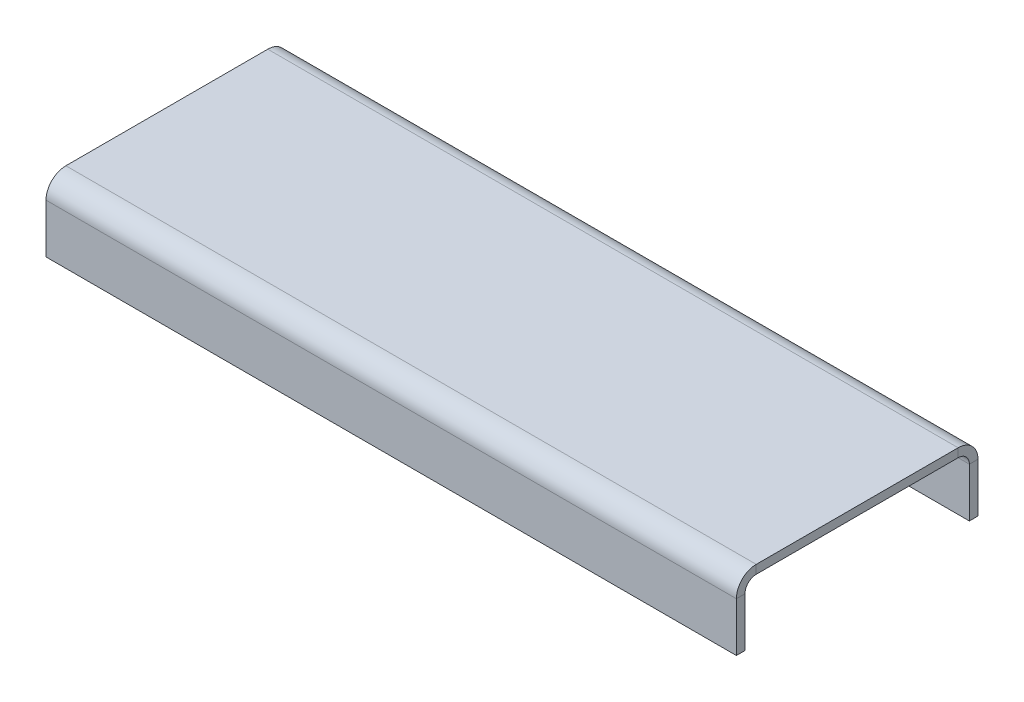
from build123d import *

# Parameters (mm, degrees)
SKETCH1_W                      = 800
SKETCH1_H                      = 280
BASE_FLANGE1_DEPTH             = 10
EDGE_FLANGE1_STRIP_W           = 66
EDGE_FLANGE1_STRIP_H           = 10
EDGE_FLANGE1_STRIP_CUT_DEPTH   = 800
EDGE_FLANGE1_STRIP_2_W         = 66
EDGE_FLANGE1_STRIP_2_H         = 10
EDGE_FLANGE1_STRIP_CUT_2_DEPTH = 800
EDGE_FLANGE1_DEPTH             = 800
EDGE_FLANGE1_BEND_DEPTH        = 800


# Sheet-metal steps are written as plain solids
with BuildPart() as part:
    # Sketch1 → Base-Flange1 (new body)
    with BuildSketch(Plane(origin=(0, 0, 0), x_dir=(1, 0, 0), z_dir=(0, 1, 0))):
        Rectangle(SKETCH1_W, SKETCH1_H)
    extrude(amount=-BASE_FLANGE1_DEPTH)

    # Edge-Flange1 strip (across the edge) → Edge-Flange1 strip cut (cut)
    with BuildSketch(Plane(origin=(400, -10, 140), x_dir=(0, 0, -1), z_dir=(-1, 0, 0))):
        with Locations((-10, -5)):
            Rectangle(EDGE_FLANGE1_STRIP_W, EDGE_FLANGE1_STRIP_H)
    extrude(amount=EDGE_FLANGE1_STRIP_CUT_DEPTH, mode=Mode.SUBTRACT)

    # Edge-Flange1 strip 2 (across the edge) → Edge-Flange1 strip cut 2 (cut)
    with BuildSketch(Plane(origin=(-400, -10, -140), x_dir=(0, 0, 1), z_dir=(1, 0, 0))):
        with Locations((-10, -5)):
            Rectangle(EDGE_FLANGE1_STRIP_2_W, EDGE_FLANGE1_STRIP_2_H)
    extrude(amount=EDGE_FLANGE1_STRIP_CUT_2_DEPTH, mode=Mode.SUBTRACT)

    # Edge-Flange1 section (across the edge) → Edge-Flange1 (add)
    with BuildSketch(Plane(origin=(400, -10, 140), x_dir=(0, 0, -1), z_dir=(-1, 0, 0))):
        with BuildLine():
            Line((0, 13), (0, 70))
            Line((0, 70), (10, 70))
            Line((10, 70), (10, 13))
            ThreePointArc((10, 13), (13.807611845, 3.807611845), (23, 0))
            Line((23, 0), (23, -10))
            ThreePointArc((23, -10), (6.736544033, -3.263455967), (0, 13))
        make_face()
    extrude(amount=EDGE_FLANGE1_DEPTH)

    # Edge-Flange1 section 2 (across the edge) → Edge-Flange1 bend (add)
    with BuildSketch(Plane(origin=(-400, -10, -140), x_dir=(0, 0, 1), z_dir=(1, 0, 0))):
        with BuildLine():
            Line((0, 13), (0, 70))
            Line((0, 70), (10, 70))
            Line((10, 70), (10, 13))
            ThreePointArc((10, 13), (13.807611845, 3.807611845), (23, 0))
            Line((23, 0), (23, -10))
            ThreePointArc((23, -10), (6.736544033, -3.263455967), (0, 13))
        make_face()
    extrude(amount=EDGE_FLANGE1_BEND_DEPTH)


solid = part.part
